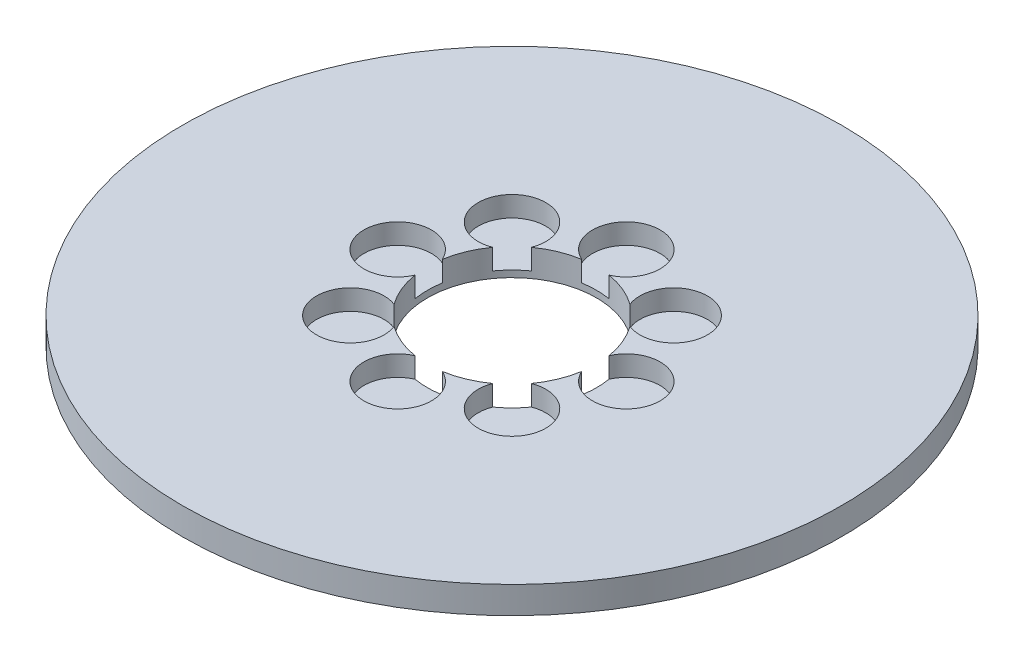
from build123d import *

# Parameters (mm, degrees)
SKETCH1_R           = 97.5
BOSS_EXTRUDE1_DEPTH = 8
SKETCH2_R           = 25
CUT_EXTRUDE1_DEPTH  = 139.117703427
SKETCH3_R           = 10
CUT_EXTRUDE2_DEPTH  = 6.043521329
CIRPATTERN1_COUNT   = 8


with BuildPart() as part:
    # Sketch1 → Boss-Extrude1 (new body)
    with BuildSketch(Plane(origin=(0, 0, 0), x_dir=(1, 0, 0), z_dir=(0, 1, 0))):
        Circle(SKETCH1_R)
    extrude(amount=BOSS_EXTRUDE1_DEPTH)

    # Sketch2 → Cut-Extrude1 (cut, through all)
    with BuildSketch(Plane(origin=(0, 0, 0), x_dir=(1, 0, 0), z_dir=(0, 1, 0))):
        Circle(SKETCH2_R)
    extrude(amount=CUT_EXTRUDE1_DEPTH, mode=Mode.SUBTRACT)

    # Sketch3 → Cut-Extrude2 (cut)
    with BuildSketch(Plane(origin=(0, 8, 0), x_dir=(1, 0, 0), z_dir=(0, 1, 0))):
        with Locations((-33.820866295, 0)):
            Circle(SKETCH3_R)
    cut_extrude2 = extrude(amount=-CUT_EXTRUDE2_DEPTH, mode=Mode.SUBTRACT)

    # CirPattern1: Cut-Extrude2 ×8 about axis
    cirpattern1_axis = Axis((0, 0, 0), (0, 1, 0))
    for i in range(1, CIRPATTERN1_COUNT):
        add(cut_extrude2.rotate(cirpattern1_axis, i * 360 / CIRPATTERN1_COUNT), mode=Mode.SUBTRACT)


solid = part.part
